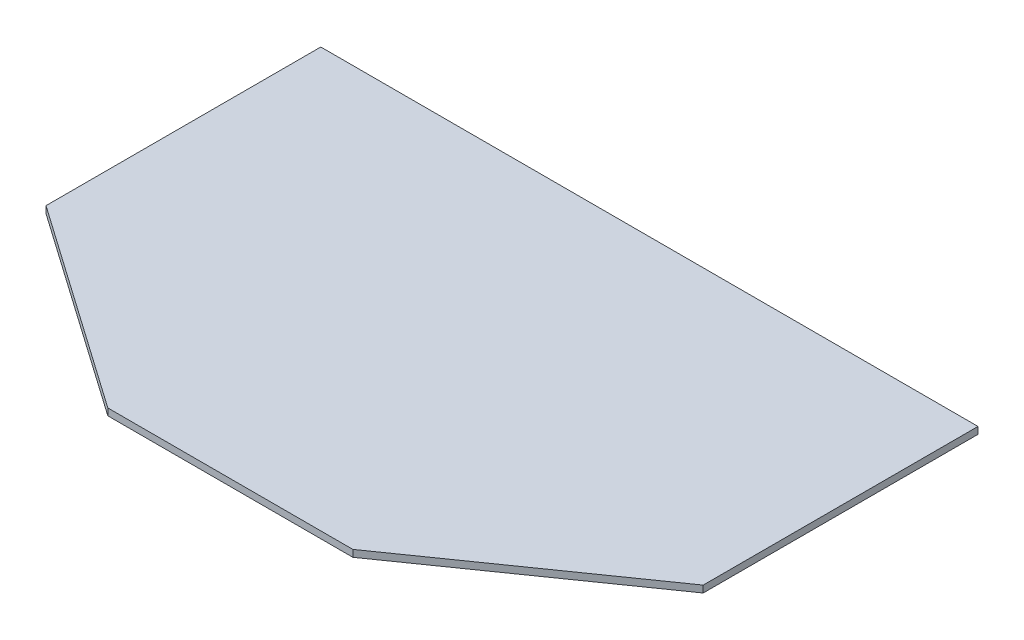
from build123d import *

# Parameters (mm, degrees)
BOSS_EXTRUDE1_DEPTH = 3


with BuildPart() as part:
    # Sketch1 → Boss-Extrude1 (new body)
    with BuildSketch(Plane(origin=(0, 0, 0), x_dir=(1, 0, 0), z_dir=(0, 1, 0))):
        Polygon((-143.5, -60), (-53.5, -123), (53.5, -123), (143.5, -60), (143.5, 60), (-143.5, 60), align=None)
    extrude(amount=BOSS_EXTRUDE1_DEPTH)


solid = part.part
